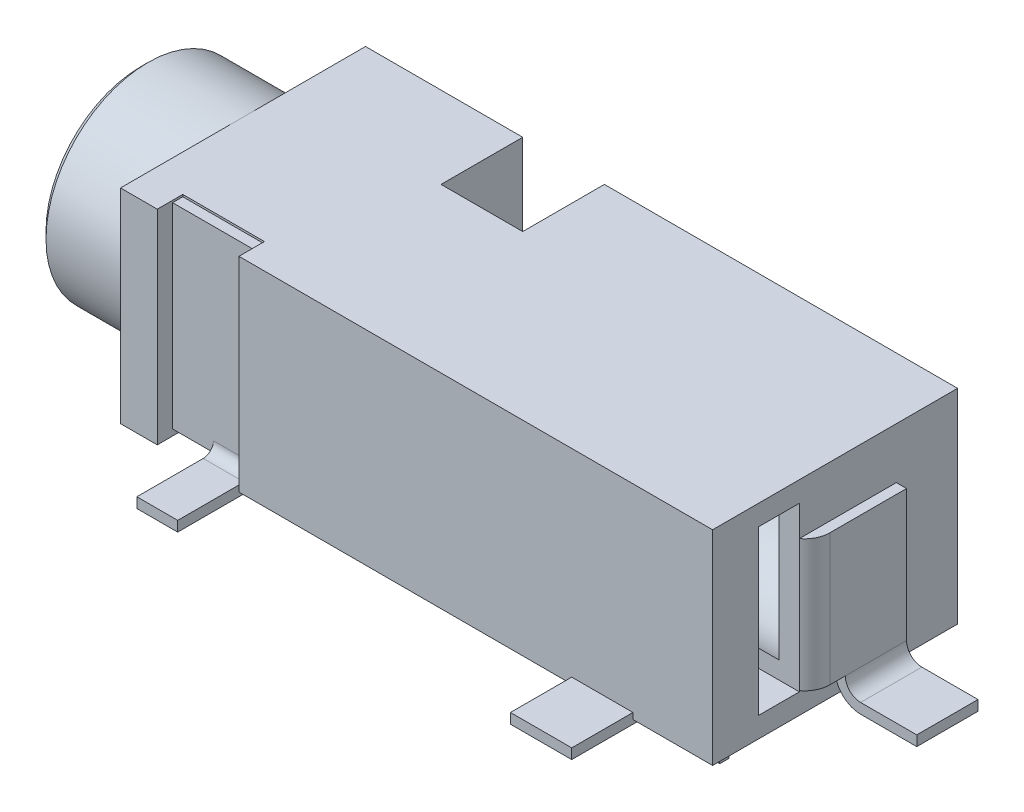
from build123d import *

# Parameters (mm, degrees)
SKETCH1_W            = 0.625
SKETCH1_H            = 1.5
REVOLVE1_ANGLE       = 90
BOSS_EXTRUDE1_DEPTH  = 4.475
SKETCH3_W            = 4.5
SKETCH3_H            = 4.475
BOSS_EXTRUDE2_DEPTH  = 12.6
SKETCH4_W            = 12.6
SKETCH4_H            = 4.5
BOSS_EXTRUDE3_DEPTH  = 0.525
SKETCH5_W            = 1.5
SKETCH5_H            = 5.1
BOSS_EXTRUDE4_DEPTH  = 1.375
SKETCH6_W            = 1.75
SKETCH6_H            = 1.5
CUT_EXTRUDE1_DEPTH   = 4.475
SKETCH7_W            = 1.75
SKETCH7_H            = 1.5
CUT_EXTRUDE2_DEPTH   = 0.375
CUT_EXTRUDE3_START   = -1.25
CUT_EXTRUDE3_DEPTH   = 1.25
SKETCH9_W            = 12.6
SKETCH9_H            = 5
BOSS_EXTRUDE5_DEPTH  = 1.5
BOSS_EXTRUDE6_START  = 1.9
BOSS_EXTRUDE6_DEPTH  = 1
SKETCH11_W           = 5.625
SKETCH11_H           = 5
BOSS_EXTRUDE7_DEPTH  = 1.9
SKETCH12_W           = 0.9
SKETCH12_H           = 5
BOSS_EXTRUDE8_DEPTH  = 0.375
CUT_EXTRUDE4_REACH   = 19.458
SKETCH14_W           = 1
SKETCH14_H           = 0.25
SKETCH15_W           = 1
SKETCH15_H           = 0.375
CUT_EXTRUDE5_DEPTH   = 4.85
SKETCH16_W           = 1
SKETCH16_H           = 0.25
BOSS_EXTRUDE9_DEPTH  = 1.5
BOSS_EXTRUDE10_REACH = 19.847
SKETCH18_W           = 1.5
SKETCH18_H           = 0.25
BOSS_EXTRUDE11_DEPTH = 1.5
SKETCH19_W           = 1
SKETCH19_H           = 4
CUT_EXTRUDE6_DEPTH   = 2
CUT_EXTRUDE7_REACH   = 20.059
SKETCH21_W           = 2
SKETCH21_H           = 0.05
SKETCH22_W           = 2
SKETCH22_H           = 4.5
CUT_EXTRUDE8_DEPTH   = 2
SKETCH23_W           = 2.5
SKETCH23_H           = 2.5
SKETCH24_W           = 0.75
SKETCH24_H           = 0.8
SKETCH25_W           = 0.75
SKETCH25_H           = 0.8
HOLE1_D              = 3.6
HOLE1_DEPTH          = 16.5
CHAMFER1_SIZE        = 0.175
FILLET1_R            = 0.25
FILLET2_R            = 0.375


# Read off the part's stored shape, not the designer's step: Boss-Extrude6
with BuildPart() as part:
    # Sketch1 → Revolve1 (revolve)
    with BuildSketch(Plane(origin=(0, 0.525, 0), x_dir=(1, 0, 0), z_dir=(0, 1, 0))):
        with Locations((14.8125, 0.75)):
            Rectangle(SKETCH1_W, SKETCH1_H)
    revolve(axis=Axis((15.125, 0.525, 0), (0, 0, 1)), revolution_arc=REVOLVE1_ANGLE)

    # Sketch2 → Boss-Extrude1 (add)
    with BuildSketch(Plane(origin=(0, 0.525, 0), x_dir=(-1, 0, 0), z_dir=(0, 1, 0))):
        with BuildLine():
            Line((-14.5, -1.5), (-15.125, -1.5))
            Line((-15.125, -1.5), (-15.125, 0))
            Line((-15.125, 0), (-14.75, 0))
            Line((-14.75, 0), (-14.75, 0.375))
            ThreePointArc((-14.75, 0.375), (-14.684016994, 0.654508497), (-14.5, 0.875))
            Line((-14.5, 0.875), (-14.5, -1.5))
        make_face()
    extrude(amount=BOSS_EXTRUDE1_DEPTH)

    # Sketch3 → Boss-Extrude2 (add)
    with BuildSketch(Plane.ZY.offset(-14.5)):
        with Locations((0.75, 2.7625)):
            Rectangle(SKETCH3_W, SKETCH3_H)
    extrude(amount=BOSS_EXTRUDE2_DEPTH)

    # Sketch4 → Boss-Extrude3 (add)
    with BuildSketch(Plane.XZ.offset(-0.525)):
        with Locations((8.2, 0.75)):
            Rectangle(SKETCH4_W, SKETCH4_H)
    extrude(amount=BOSS_EXTRUDE3_DEPTH)

    # Sketch5 → Boss-Extrude4 (add)
    with BuildSketch(Plane(origin=(15.125, 0, 0), x_dir=(0, 0, -1), z_dir=(1, 0, 0))):
        with Locations((0.75, 2.45)):
            Rectangle(SKETCH5_W, SKETCH5_H)
    extrude(amount=BOSS_EXTRUDE4_DEPTH)

    # Sketch6 → Cut-Extrude1 (cut)
    with BuildSketch(Plane(origin=(0, 5, 0), x_dir=(-1, 0, 0), z_dir=(0, 1, 0))):
        with Locations((-15.625, -0.75)):
            Rectangle(SKETCH6_W, SKETCH6_H)
    extrude(amount=-CUT_EXTRUDE1_DEPTH, mode=Mode.SUBTRACT)

    # Sketch7 → Cut-Extrude2 (cut)
    with BuildSketch(Plane(origin=(0, 0.525, 0), x_dir=(-1, 0, 0), z_dir=(0, 1, 0))):
        with Locations((-15.625, -0.75)):
            Rectangle(SKETCH7_W, SKETCH7_H)
    extrude(amount=-CUT_EXTRUDE2_DEPTH, mode=Mode.SUBTRACT)

    # Sketch8 → Cut-Extrude3 (cut)
    with BuildSketch(Plane(origin=(0, 5, 0), x_dir=(-1, 0, 0), z_dir=(0, 1, 0)).offset(CUT_EXTRUDE3_START)):
        with BuildLine():
            Line((-14.75, -1.5), (-14.5, -1.5))
            Line((-14.5, -1.5), (-14.5, 0.875))
            ThreePointArc((-14.5, 0.875), (-14.684016994, 0.654508497), (-14.75, 0.375))
            Line((-14.75, 0.375), (-14.75, -1.5))
        make_face()
    extrude(amount=CUT_EXTRUDE3_DEPTH, mode=Mode.SUBTRACT)

    # Sketch9 → Boss-Extrude5 (add)
    with BuildSketch(Plane(origin=(0, 0, -1.5), x_dir=(-1, 0, 0), z_dir=(0, 0, -1))):
        with Locations((-8.2, 2.5)):
            Rectangle(SKETCH9_W, SKETCH9_H)
    extrude(amount=BOSS_EXTRUDE5_DEPTH)

    # Boss-Extrude6 outline → Boss-Extrude6 (add)
    with BuildSketch(Plane.YZ.offset(BOSS_EXTRUDE6_START)):
        with BuildLine():
            Line((0, 3), (-0.1, 3))
            Line((-0.1, 3), (-0.1, 2.548205081))
            ThreePointArc((-0.1, 2.548205081), (-0.073205081, 2.448205081), (0, 2.375))
            Line((0, 2.375), (0, 3))
        make_face()
    extrude(amount=BOSS_EXTRUDE6_DEPTH)

    # Sketch11 → Boss-Extrude7 (add)
    with BuildSketch(Plane.ZY.offset(-1.9)):
        with Locations((-0.1875, 2.5)):
            Rectangle(SKETCH11_W, SKETCH11_H)
    extrude(amount=BOSS_EXTRUDE7_DEPTH)

    # Sketch12 → Boss-Extrude8 (add)
    with BuildSketch(Plane.XY.offset(2.625)):
        with Locations((0.45, 2.5)):
            Rectangle(SKETCH12_W, SKETCH12_H)
    extrude(amount=BOSS_EXTRUDE8_DEPTH)

    # Sketch14 → Cut-Extrude4 (cut, up to next)
    with BuildSketch(Plane(origin=(0, 0.15, 0), x_dir=(1, 0, 0), z_dir=(0, 1, 0)), mode=Mode.PRIVATE) as cut_extrude4_sk1:
        with Locations((1.4, -2.5)):
            Rectangle(SKETCH14_W, SKETCH14_H)
    cut_extrude4_tool1 = extrude(cut_extrude4_sk1.sketch, amount=-CUT_EXTRUDE4_REACH, mode=Mode.PRIVATE) & part.part
    add(cut_extrude4_tool1.solids().sort_by_distance((1.4, 0.15, 2.5))[0], mode=Mode.SUBTRACT)

    # Sketch15 → Cut-Extrude5 (cut)
    with BuildSketch(Plane(origin=(0, 5, 0), x_dir=(-1, 0, 0), z_dir=(0, 1, 0))):
        with Locations((-2.4, 2.8125)):
            Rectangle(SKETCH15_W, SKETCH15_H)
    extrude(amount=-CUT_EXTRUDE5_DEPTH, mode=Mode.SUBTRACT)

    # Sketch16 → Boss-Extrude9 (add)
    with BuildSketch(Plane.XY.offset(3)):
        with Locations((2.4, 0.025)):
            Rectangle(SKETCH16_W, SKETCH16_H)
    extrude(amount=BOSS_EXTRUDE9_DEPTH)

    # Sketch17 → Boss-Extrude10 (add, up to next)
    with BuildSketch(Plane.XZ.offset(0.1), mode=Mode.PRIVATE) as boss_extrude10_sk1:
        Polygon((12.55, 2.775), (12.55, 3), (11.05, 3), (11.05, 2.548205081), (14.45, 2.548205081), (14.45, 2.775), align=None)
    boss_extrude10_tool1 = extrude(boss_extrude10_sk1.sketch, amount=-BOSS_EXTRUDE10_REACH, mode=Mode.PRIVATE) - part.part
    add(boss_extrude10_tool1.solids().sort_by_distance((12.460785, -0.1, 2.730374))[0])

    # Sketch18 → Boss-Extrude11 (add)
    with BuildSketch(Plane.XY.offset(3)):
        with Locations((11.8, 0.025)):
            Rectangle(SKETCH18_W, SKETCH18_H)
    extrude(amount=BOSS_EXTRUDE11_DEPTH)

    # Sketch19 → Cut-Extrude6 (cut)
    with BuildSketch(Plane(origin=(14.5, 0, 0), x_dir=(0, 0, -1), z_dir=(1, 0, 0))):
        with Locations((-1.375, 2.5)):
            Rectangle(SKETCH19_W, SKETCH19_H)
    extrude(amount=-CUT_EXTRUDE6_DEPTH, mode=Mode.SUBTRACT)

    # Sketch21 → Cut-Extrude7 (cut, up to next)
    with BuildSketch(Plane(origin=(0, 0, 2.375), x_dir=(-1, 0, 0), z_dir=(0, 0, -1)), mode=Mode.PRIVATE) as cut_extrude7_sk1:
        with Locations((-1.9, 4.975)):
            Rectangle(SKETCH21_W, SKETCH21_H)
    cut_extrude7_tool1 = extrude(cut_extrude7_sk1.sketch, amount=-CUT_EXTRUDE7_REACH, mode=Mode.PRIVATE) & part.part
    add(cut_extrude7_tool1.solids().sort_by_distance((1.9, 4.975, 2.375))[0], mode=Mode.SUBTRACT)

    # Sketch22 → Cut-Extrude8 (cut)
    with BuildSketch(Plane(origin=(0, 0, -3), x_dir=(-1, 0, 0), z_dir=(0, 0, -1))):
        with Locations((-4.85, 2.75)):
            Rectangle(SKETCH22_W, SKETCH22_H)
    extrude(amount=-CUT_EXTRUDE8_DEPTH, mode=Mode.SUBTRACT)

    # Sketch23 → Revolve2 (revolve)
    with BuildSketch(Plane.XY, mode=Mode.PRIVATE) as revolve2_sk:
        with Locations((-1.25, 3.75)):
            Rectangle(SKETCH23_W, SKETCH23_H)
    revolve(revolve2_sk.sketch.rotate(Axis((-2.5, 2.5, 0), (1, 0, 0)), 270), axis=Axis((-2.5, 2.5, 0), (1, 0, 0)))

    # Sketch24 → Revolve3 (revolve)
    with BuildSketch(Plane.XY, mode=Mode.PRIVATE) as revolve3_sk:
        with Locations((3.875, -0.4)):
            Rectangle(SKETCH24_W, SKETCH24_H)
    revolve(revolve3_sk.sketch.rotate(Axis((3.5, 0, 0), (0, -1, 0)), 270), axis=Axis((3.5, 0, 0), (0, -1, 0)))

    # Sketch25 → Revolve4 (revolve)
    with BuildSketch(Plane.XY, mode=Mode.PRIVATE) as revolve4_sk:
        with Locations((10.875, -0.4)):
            Rectangle(SKETCH25_W, SKETCH25_H)
    revolve(revolve4_sk.sketch.rotate(Axis((10.5, 0, 0), (0, -1, 0)), 270), axis=Axis((10.5, 0, 0), (0, -1, 0)))

    # Hole1
    with Locations(Plane.ZY.offset(2.5)):
        with Locations((0, 2.5)):
            Hole(HOLE1_D / 2, depth=HOLE1_DEPTH)

    # Chamfer1
    chamfer1_edges = [part.edges().sort_by_distance(p)[0] for p in [
        (-2.5, 2.5, 2.5),
        (-2.5, 2.5, 1.8),
    ]]
    chamfer(chamfer1_edges, length=CHAMFER1_SIZE)

    # Fillet1
    fillet1_edges = [part.edges().sort_by_distance(p)[0] for p in [
        (2.4, 0.15, 2.625),
        (3.5, -0.8, 0.75),
        (10.5, -0.8, 0.75),
    ]]
    fillet(fillet1_edges, radius=FILLET1_R)

    # Fillet2
    fillet2_edges = [part.edges().sort_by_distance(p)[0] for p in [
        (14.75, 0.15, -0.75),
    ]]
    fillet(fillet2_edges, radius=FILLET2_R)


solid = part.part
